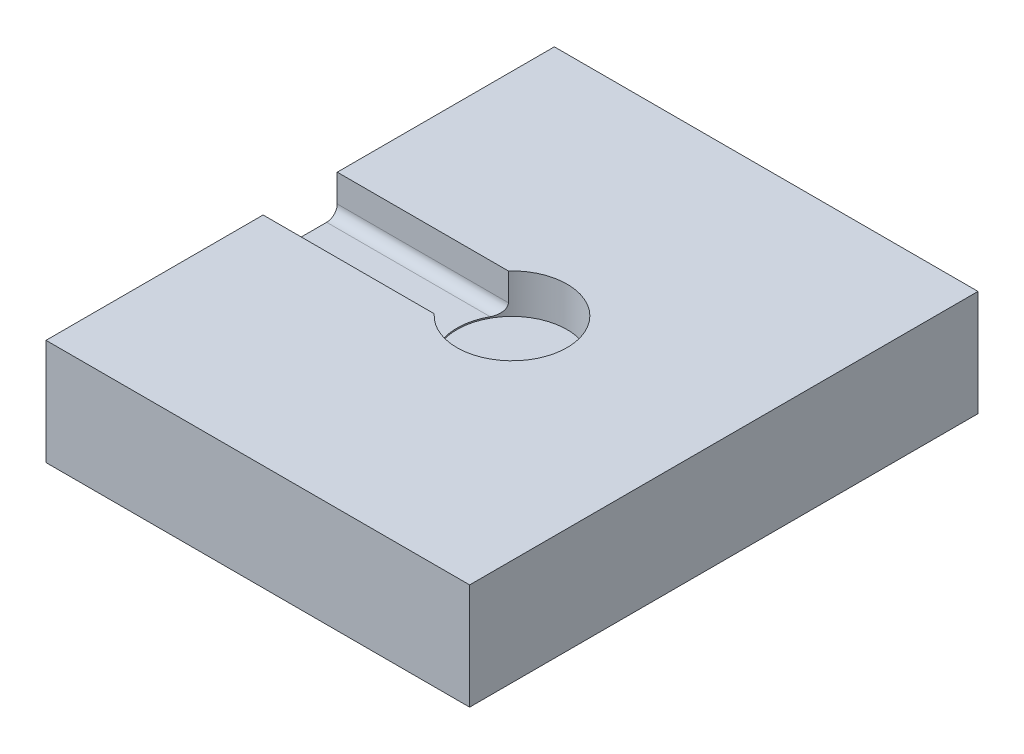
from build123d import *

# Parameters (mm, degrees)
SKETCH1_W           = 200
SKETCH1_H           = 240
BASE_DEPTH          = 50
SKETCH2_R           = 26
LOAD_CELL_CUT_DEPTH = 18.6
WIRE_CUT_REACH      = 240.537
SKETCH3_W           = 35
SKETCH3_H           = 18
WIRE_CUT_FILLET_R   = 5


with BuildPart() as part:
    # Sketch1 → base (new body)
    with BuildSketch(Plane(origin=(0, 0, 0), x_dir=(1, 0, 0), z_dir=(0, 1, 0))):
        Rectangle(SKETCH1_W, SKETCH1_H)
    extrude(amount=BASE_DEPTH)

    # Sketch2 → load cell cut (cut)
    with BuildSketch(Plane(origin=(0, 50, 0), x_dir=(1, 0, 0), z_dir=(0, 1, 0))):
        Circle(SKETCH2_R)
    extrude(amount=-LOAD_CELL_CUT_DEPTH, mode=Mode.SUBTRACT)

    # Sketch3 → wire cut (cut, up to next)
    with BuildSketch(Plane(origin=(-100, 0, 0), x_dir=(0, 0, -1), z_dir=(1, 0, 0)), mode=Mode.PRIVATE) as wire_cut_sk1:
        with Locations((0, 41)):
            Rectangle(SKETCH3_W, SKETCH3_H)
    wire_cut_tool1 = extrude(wire_cut_sk1.sketch, amount=WIRE_CUT_REACH, mode=Mode.PRIVATE) & part.part
    add(wire_cut_tool1.solids().sort_by_distance((-100, 41, 0))[0], mode=Mode.SUBTRACT)

    # wire cut fillet
    wire_cut_fillet_edges = [part.edges().sort_by_distance(p)[0] for p in [
        (-59.614442262, 32, 17.5),
        (-59.614442262, 32, -17.5),
    ]]
    fillet(wire_cut_fillet_edges, radius=WIRE_CUT_FILLET_R)


solid = part.part
